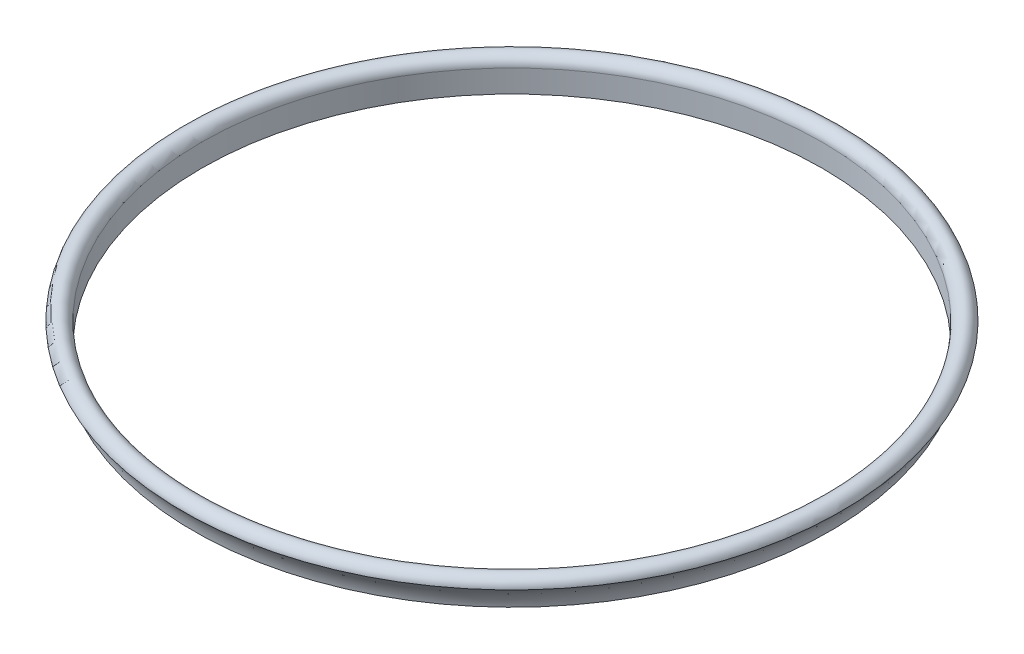
from build123d import *


with BuildPart() as part:
    # Sketch1 → Revolve1 (revolve)
    with BuildSketch(Plane.XY):
        with BuildLine():
            Line((82.55, 0), (82.55, 6))
            ThreePointArc((82.55, 6), (85.020831476, 8.539058037), (87.626232847, 6.138285746))
            ThreePointArc((87.626232847, 6.138285746), (85.561991757, 3.338005188), (84.582, 0))
            Line((84.582, 0), (82.55, 0))
        make_face()
    revolve(axis=Axis((0, 0, 0), (0, 1, 0)))


solid = part.part
